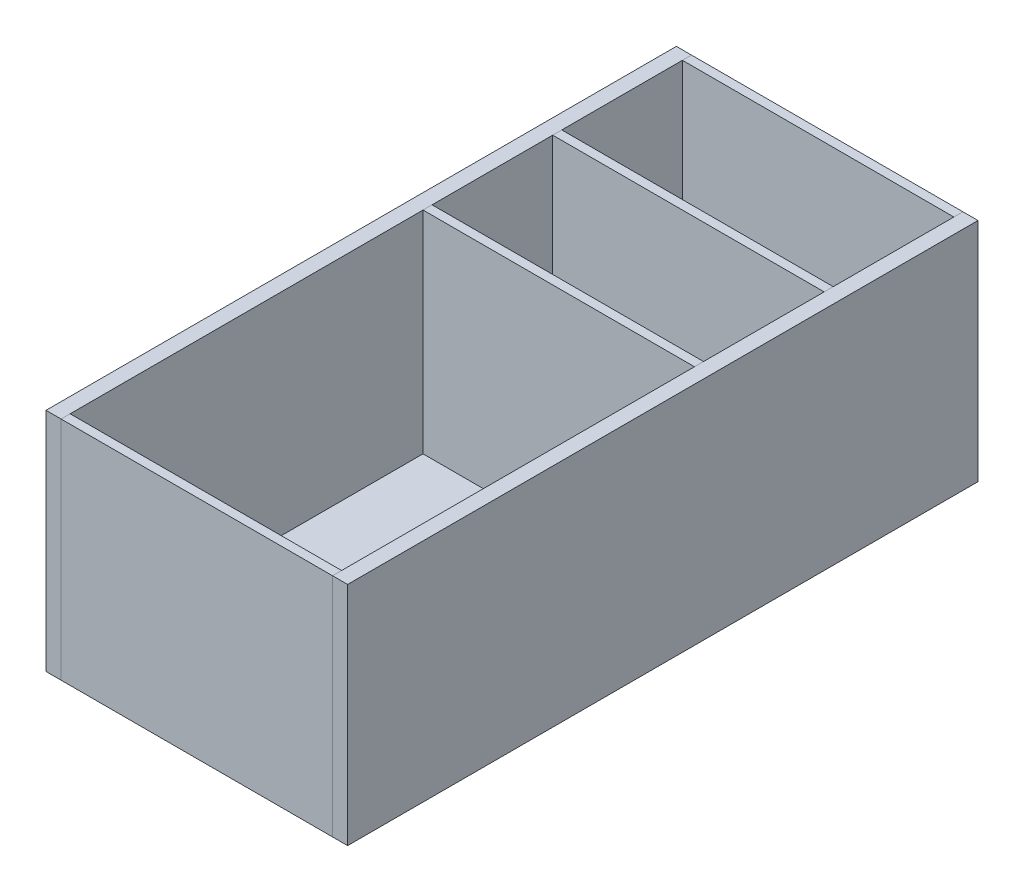
from build123d import *

# Parameters (mm, degrees)
BOSS_EXTRUDE2_DEPTH      = 163
BOSS_EXTRUDE2_DEPTH_BACK = 40
SKETCH1_3_W              = 90
SKETCH1_3_H              = 70
BOSS_EXTRUDE3_DEPTH      = 3
SKETCH2_W                = 90
SKETCH2_H                = 70
BOSS_EXTRUDE4_DEPTH      = 3
SKETCH4_W                = 100
SKETCH4_H                = 75
BOSS_EXTRUDE6_DEPTH      = 3
SKETCH6_W                = 100
SKETCH6_H                = 75
BOSS_EXTRUDE7_DEPTH      = 3
SPLIT1_START             = -50
SPLIT1_OUTLINE_W         = 75
SPLIT1_OUTLINE_H         = 209
SPLIT1_DEPTH             = 5
SPLIT1_2_OUTLINE_W       = 75
SPLIT1_2_OUTLINE_H       = 209
SPLIT1_2_DEPTH           = 5
SPLIT1_START_2           = 45
SPLIT1_3_OUTLINE_W       = 75
SPLIT1_3_OUTLINE_H       = 209
SPLIT1_3_DEPTH           = 5
SPLIT1_4_OUTLINE_W       = 75
SPLIT1_4_OUTLINE_H       = 209
SPLIT1_4_DEPTH           = 5


# Read off the part's stored shape, not the designer's step: Split1
with BuildPart() as part:
    # Sketch1 → Boss-Extrude2 (new, two sides: drawn at the far end of the back side and taken through both)
    with BuildSketch(Plane.XY.offset(-BOSS_EXTRUDE2_DEPTH_BACK)):
        Polygon((-45, -35), (-45, 35), (-50, 35), (-50, -40), (50, -40), (50, 35), (45, 35), (45, -35), align=None)
    extrude(amount=BOSS_EXTRUDE2_DEPTH + BOSS_EXTRUDE2_DEPTH_BACK)

    # Sketch1<3> → Boss-Extrude3 (add)
    with BuildSketch(Plane.XY):
        Rectangle(SKETCH1_3_W, SKETCH1_3_H)
    extrude(amount=BOSS_EXTRUDE3_DEPTH)

    # Sketch2 → Boss-Extrude4 (add)
    with BuildSketch(Plane.XY.offset(43)):
        Rectangle(SKETCH2_W, SKETCH2_H)
    extrude(amount=BOSS_EXTRUDE4_DEPTH)

    # Sketch4 → Boss-Extrude6 (add)
    with BuildSketch(Plane(origin=(0, 0, -40), x_dir=(-1, 0, 0), z_dir=(0, 0, -1))):
        with Locations((0, -2.5)):
            Rectangle(SKETCH4_W, SKETCH4_H)
    extrude(amount=BOSS_EXTRUDE6_DEPTH)

    # Sketch6 → Boss-Extrude7 (add)
    with BuildSketch(Plane.XY.offset(163)):
        with Locations((0, -2.5)):
            Rectangle(SKETCH6_W, SKETCH6_H)
    extrude(amount=BOSS_EXTRUDE7_DEPTH)

    # Split1 2 outline → Split1 2 (cut)
    with BuildSketch(Plane.YZ.offset(SPLIT1_START)):
        with Locations((-2.5, 61.5)):
            Rectangle(SPLIT1_2_OUTLINE_W, SPLIT1_2_OUTLINE_H)
    extrude(amount=SPLIT1_2_DEPTH, mode=Mode.SUBTRACT)

    # Split1 3 outline → Split1 3 (cut)
    with BuildSketch(Plane.YZ.offset(SPLIT1_START_2)):
        with Locations((-2.5, 61.5)):
            Rectangle(SPLIT1_3_OUTLINE_W, SPLIT1_3_OUTLINE_H)
    extrude(amount=SPLIT1_3_DEPTH, mode=Mode.SUBTRACT)


with BuildPart() as body_2:
    # Split1 outline → Split1 (new body)
    with BuildSketch(Plane.YZ.offset(SPLIT1_START)):
        with Locations((-2.5, 61.5)):
            Rectangle(SPLIT1_OUTLINE_W, SPLIT1_OUTLINE_H)
    extrude(amount=SPLIT1_DEPTH)


with BuildPart() as body_3:
    # Split1 4 outline → Split1 4 (new body)
    with BuildSketch(Plane.YZ.offset(SPLIT1_START_2)):
        with Locations((-2.5, 61.5)):
            Rectangle(SPLIT1_4_OUTLINE_W, SPLIT1_4_OUTLINE_H)
    extrude(amount=SPLIT1_4_DEPTH)


solid = Compound([part.part, body_2.part, body_3.part])
